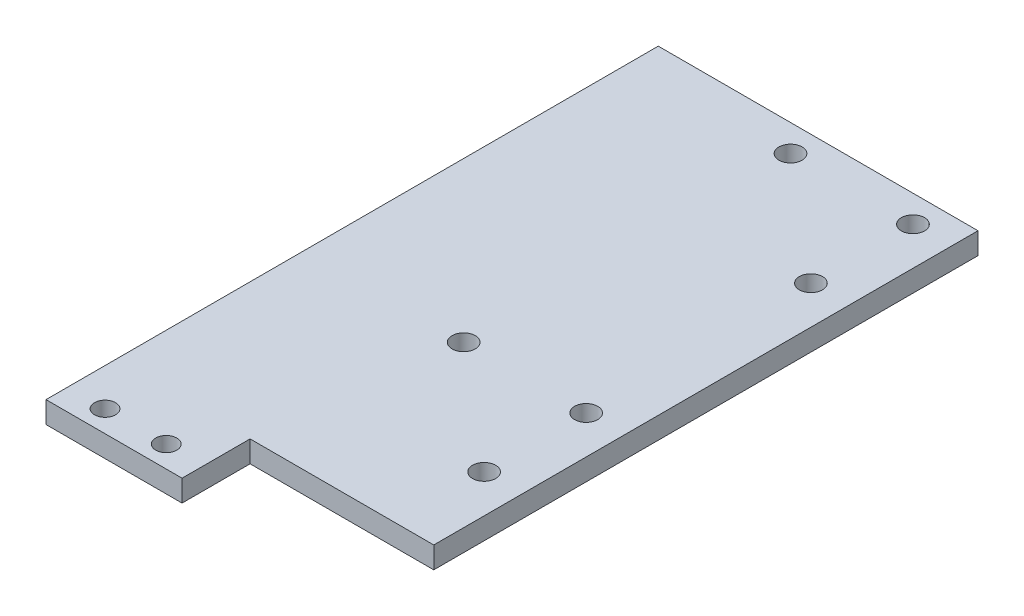
from build123d import *

# Parameters (mm, degrees)
SKETCH1_R           = 1.7
SKETCH1_R_2         = 1.55
BOSS_EXTRUDE1_DEPTH = 3.175


with BuildPart() as part:
    # Sketch1 → Boss-Extrude1 (new body)
    with BuildSketch(Plane(origin=(0, 0, 0), x_dir=(1, 0, 0), z_dir=(0, 1, 0))):
        Polygon((0, 0), (0, 90), (47, 90), (47, 10), (20, 10), (20, 0), align=None)
        with Locations((41.4, 86.041124028)):
            Circle(SKETCH1_R, mode=Mode.SUBTRACT)
        with Locations((14.5, 3.175)):
            Circle(SKETCH1_R_2, mode=Mode.SUBTRACT)
        with Locations((23.4, 86.041124028)):
            Circle(SKETCH1_R, mode=Mode.SUBTRACT)
        with Locations((5.5, 3.175)):
            Circle(SKETCH1_R_2, mode=Mode.SUBTRACT)
        with Locations((41.4, 23)):
            Circle(SKETCH1_R, mode=Mode.SUBTRACT)
        with Locations((41.4, 38)):
            Circle(SKETCH1_R, mode=Mode.SUBTRACT)
        with Locations((23.4, 38)):
            Circle(SKETCH1_R, mode=Mode.SUBTRACT)
        with Locations((41.4, 71.041124028)):
            Circle(SKETCH1_R, mode=Mode.SUBTRACT)
    extrude(amount=BOSS_EXTRUDE1_DEPTH)


solid = part.part
